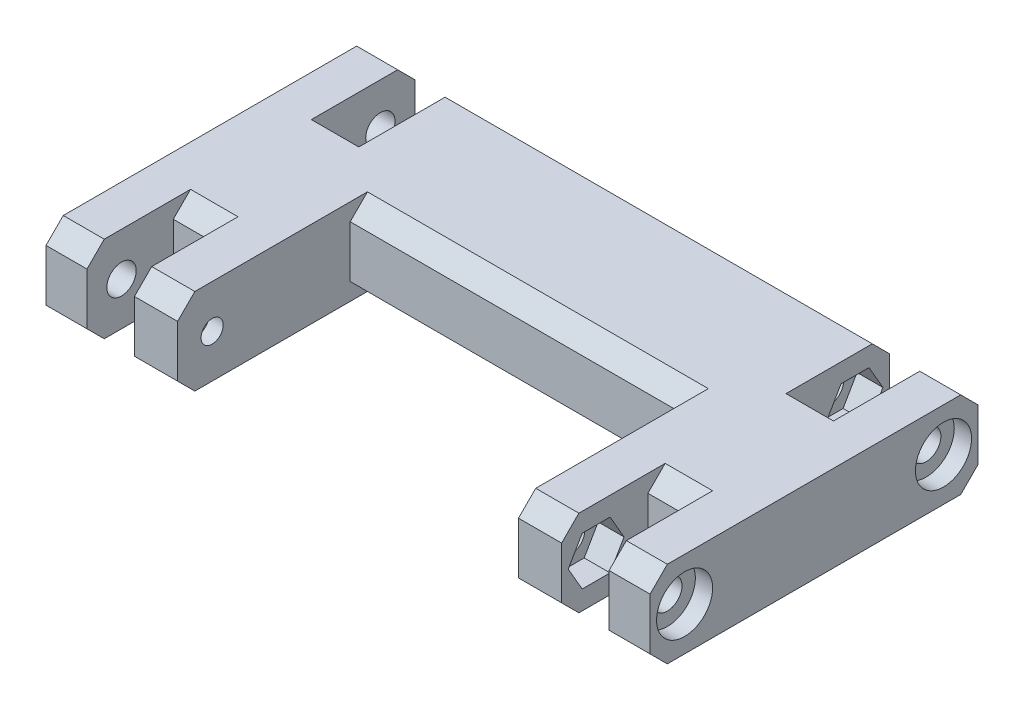
from build123d import *

# Parameters (mm, degrees)
SKETCH1_W            = 70
SKETCH1_H            = 38
BOSS_EXTRUDE1_DEPTH  = 10
SKETCH2_W            = 5.5
SKETCH2_H            = 10
CUT_EXTRUDE1_DEPTH   = 42.060930335
CUT_EXTRUDE2_DEPTH   = 3
MIRROR2_COPY_2_DEPTH = 3
CHAMFER1_SIZE        = 2
SKETCH10_W           = 39.5
SKETCH10_H           = 20
CUT_EXTRUDE3_DEPTH   = 42.060930335
CHAMFER2_SIZE        = 2
CHAMFER3_SIZE        = 2


with BuildPart() as part:
    # Sketch1 → Boss-Extrude1 (new body)
    with BuildSketch(Plane(origin=(0, 0, 0), x_dir=(1, 0, 0), z_dir=(0, 1, 0))):
        Rectangle(SKETCH1_W, SKETCH1_H)
    extrude(amount=BOSS_EXTRUDE1_DEPTH)

    # Sketch2 → Cut-Extrude1 (cut, through all)
    with BuildSketch(Plane(origin=(0, 10, 0), x_dir=(1, 0, 0), z_dir=(0, 1, 0))):
        with Locations((-27.5, 14)):
            Rectangle(SKETCH2_W, SKETCH2_H)
        with Locations((27.5, 14)):
            Rectangle(SKETCH2_W, SKETCH2_H)
    cut_extrude1 = extrude(amount=-CUT_EXTRUDE1_DEPTH, mode=Mode.SUBTRACT)

    # Sketch8 → CBORE for M3 Cheese Head Screw1 (revolve, cut)
    with BuildSketch(Plane(origin=(35, 5, -15), x_dir=(0, 0, -1), z_dir=(0, 1, 0))):
        Polygon((0, 0), (0, 16.021463052), (1.7, 15), (1.7, 2), (3.25, 2), (3.25, 0), align=None)
    cbore_for_m3_cheese_head_screw1 = revolve(axis=Axis((41.35, 5, -15), (-1, 0, 0)), mode=Mode.SUBTRACT)

    # Sketch9 → Cut-Extrude2 (cut)
    with BuildSketch(Plane(origin=(24.75, 0, 0), x_dir=(0, 0, -1), z_dir=(1, 0, 0))):
        Polygon((16.616580754, 7.8), (13.383419246, 7.8), (11.766838493, 5), (13.383419246, 2.2), (16.616580754, 2.2), (18.233161507, 5), align=None)
    cut_extrude2 = extrude(amount=-CUT_EXTRUDE2_DEPTH, mode=Mode.SUBTRACT)

    # Mirror1: CBORE for M3 Cheese Head Screw1, Cut-Extrude2 across plane
    add(cbore_for_m3_cheese_head_screw1.mirror(Plane(origin=(0, 0, 0), x_dir=(0, 0, 1), z_dir=(1, 0, 0))), mode=Mode.SUBTRACT)
    add(cut_extrude2.mirror(Plane(origin=(0, 0, 0), x_dir=(0, 0, 1), z_dir=(1, 0, 0))), mode=Mode.SUBTRACT)

    # Mirror2: Cut-Extrude1, CBORE for M3 Cheese Head Screw1, Cut-Extrude2 across plane
    add(cut_extrude1.mirror(Plane.XY), mode=Mode.SUBTRACT)
    add(cbore_for_m3_cheese_head_screw1.mirror(Plane.XY), mode=Mode.SUBTRACT)
    add(cut_extrude2.mirror(Plane.XY), mode=Mode.SUBTRACT)

    # Mirror2 copy 1 sketch → Mirror2 copy 1 (revolve, cut)
    with BuildSketch(Plane(origin=(-35, 5, 15), x_dir=(0, 0, 1), z_dir=(0, 1, 0))):
        Polygon((0, 0), (0, 16.021463052), (1.7, 15), (1.7, 2), (3.25, 2), (3.25, 0), align=None)
    revolve(axis=Axis((-41.35, 5, 15), (1, 0, 0)), mode=Mode.SUBTRACT)

    # Mirror2 copy 2 sketch → Mirror2 copy 2 (cut)
    with BuildSketch(Plane.ZY.offset(24.75)):
        Polygon((16.616580754, 7.8), (13.383419246, 7.8), (11.766838493, 5), (13.383419246, 2.2), (16.616580754, 2.2), (18.233161507, 5), align=None)
    extrude(amount=-MIRROR2_COPY_2_DEPTH, mode=Mode.SUBTRACT)

    # Chamfer1
    chamfer1_edges = [part.edges().sort_by_distance(p)[0] for p in [
        (32.625, 0, -19),
        (32.625, 10, -19),
        (0, 0, -19),
        (0, 10, -19),
        (-32.625, 0, -19),
        (-32.625, 10, -19),
        (-32.625, 0, 19),
        (32.625, 0, 19),
        (0, 0, 19),
        (32.625, 10, 19),
        (-32.625, 10, 19),
        (0, 10, 19),
    ]]
    chamfer(chamfer1_edges, length=CHAMFER1_SIZE)

    # Sketch10 → Cut-Extrude3 (cut, through all)
    with BuildSketch(Plane(origin=(0, 10, 0), x_dir=(1, 0, 0), z_dir=(0, 1, 0))):
        with Locations((0, -9)):
            Rectangle(SKETCH10_W, SKETCH10_H)
    extrude(amount=-CUT_EXTRUDE3_DEPTH, mode=Mode.SUBTRACT)

    # Chamfer2
    chamfer2_edges = [part.edges().sort_by_distance(p)[0] for p in [
        (0, 0, -1),
        (0, 10, -1),
    ]]
    chamfer(chamfer2_edges, length=CHAMFER2_SIZE)

    # Chamfer3
    chamfer3_edges = [part.edges().sort_by_distance(p)[0] for p in [
        (27.5, 0, -9),
        (27.5, 10, -9),
        (27.5, 10, 9),
        (27.5, 0, 9),
        (-27.5, 10, 9),
        (-27.5, 0, 9),
        (-27.5, 0, -9),
        (-27.5, 10, -9),
    ]]
    chamfer(chamfer3_edges, length=CHAMFER3_SIZE)


solid = part.part
